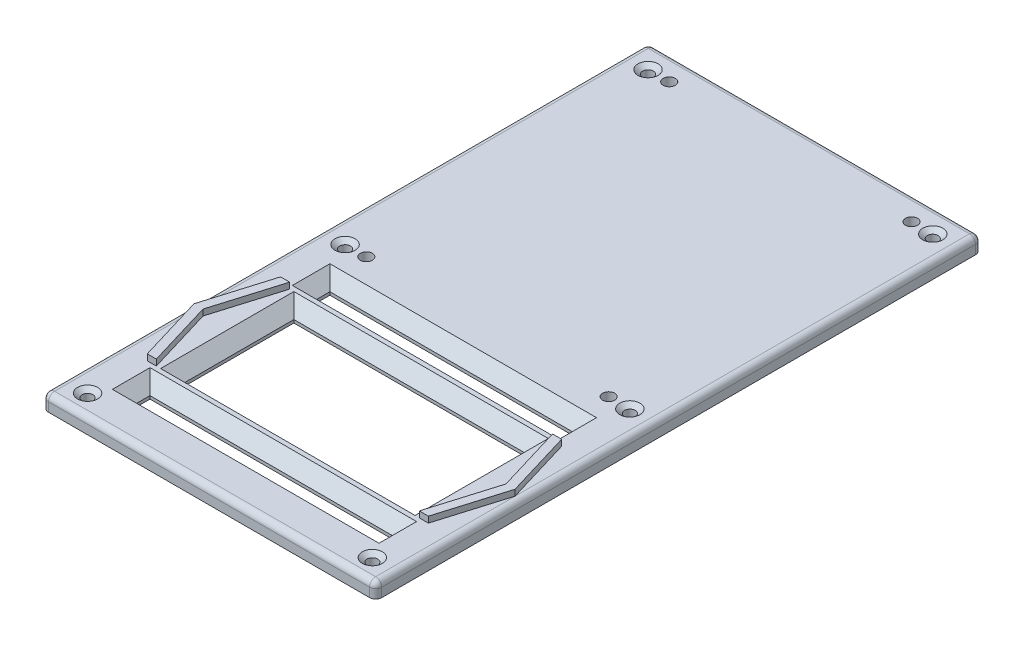
from build123d import *

# Parameters (mm, degrees)
SKETCH1_W                             = 139.7
SKETCH1_H                             = 254
BOSS_EXTRUDE1_DEPTH                   = 6.35
SKETCH2_W                             = 96.52
SKETCH2_H                             = 45.72
MAIN_HOLE_DEPTH                       = 240.117763874
SKETCH3_W                             = 101.6
SKETCH3_H                             = 5.588
NEOPIXEL_DEPTH                        = 240.117763874
CHAMFER1_SIZE                         = 5.08
CHAMFER2_SIZE                         = 5.08
CUT_EXTRUDE1_REACH                    = 241.118
SKETCH7_R                             = 2.54
BOSS_EXTRUDE4_DEPTH                   = 2.54
FRONT_BACK_MOUNTING_HOLES_D           = 4.4958
FRONT_BACK_MOUNTING_HOLES_CSINK_D     = 8.4328
FRONT_BACK_MOUNTING_HOLES_CSINK_ANGLE = 100
CORNER_FILLET_R                       = 2.54
FILLET2_R                             = 2.54


with BuildPart() as part:
    # Sketch1 → Boss-Extrude1 (new body)
    with BuildSketch(Plane(origin=(0, 0, 0), x_dir=(1, 0, 0), z_dir=(0, 1, 0))):
        with Locations((0, 101.6)):
            Rectangle(SKETCH1_W, SKETCH1_H)
    extrude(amount=BOSS_EXTRUDE1_DEPTH)

    # Sketch2 → Main Hole (cut, through all)
    with BuildSketch(Plane(origin=(0, 6.35, 0), x_dir=(1, 0, 0), z_dir=(0, 1, 0))):
        with Locations((0, 35.56)):
            Rectangle(SKETCH2_W, SKETCH2_H)
    extrude(amount=-MAIN_HOLE_DEPTH, mode=Mode.SUBTRACT)

    # Sketch3 → NeoPixel (cut, through all)
    with BuildSketch(Plane(origin=(0, 6.35, 0), x_dir=(1, 0, 0), z_dir=(0, 1, 0))):
        with Locations((0, 73.279)):
            Rectangle(SKETCH3_W, SKETCH3_H)
    neopixel = extrude(amount=-NEOPIXEL_DEPTH, mode=Mode.SUBTRACT)

    # Mirror2: NeoPixel across plane
    add(neopixel.mirror(Plane.XY.offset(-35.56)), mode=Mode.SUBTRACT)

    # Chamfer1
    chamfer1_edges = [part.edges().sort_by_distance(p)[0] for p in [
        (-50.8, 6.35, -73.279),
        (0, 6.35, -70.485),
        (50.8, 6.35, -73.279),
        (0, 6.35, -76.073),
        (-50.8, 6.35, 2.159),
        (0, 6.35, -0.635),
        (50.8, 6.35, 2.159),
        (0, 6.35, 4.953),
    ]]
    chamfer(chamfer1_edges, length=CHAMFER1_SIZE)

    # Chamfer2
    chamfer2_edges = [part.edges().sort_by_distance(p)[0] for p in [
        (48.26, 6.35, -35.56),
        (0, 6.35, -58.42),
        (-48.26, 6.35, -35.56),
        (0, 6.35, -12.7),
    ]]
    chamfer(chamfer2_edges, length=CHAMFER2_SIZE)

    # Sketch7 → Cut-Extrude1 (cut, up to next)
    with BuildSketch(Plane(origin=(0, 6.35, 0), x_dir=(1, 0, 0), z_dir=(0, 1, 0)), mode=Mode.PRIVATE) as cut_extrude1_sk1:
        with Locations(Location((50.8, 91.313, 0), (0, 0, 270))):
            Circle(SKETCH7_R)
    cut_extrude1_tool1 = extrude(cut_extrude1_sk1.sketch, amount=-CUT_EXTRUDE1_REACH, mode=Mode.PRIVATE) & part.part
    # Sketch7 → Cut-Extrude1 (cut, up to next)
    with BuildSketch(Plane(origin=(0, 6.35, 0), x_dir=(1, 0, 0), z_dir=(0, 1, 0)), mode=Mode.PRIVATE) as cut_extrude1_sk2:
        with Locations(Location((-50.8, 91.313, 0), (0, 0, 270))):
            Circle(SKETCH7_R)
    cut_extrude1_tool2 = extrude(cut_extrude1_sk2.sketch, amount=-CUT_EXTRUDE1_REACH, mode=Mode.PRIVATE) & part.part
    # Sketch7 → Cut-Extrude1 (cut, up to next)
    with BuildSketch(Plane(origin=(0, 6.35, 0), x_dir=(1, 0, 0), z_dir=(0, 1, 0)), mode=Mode.PRIVATE) as cut_extrude1_sk3:
        with Locations(Location((-50.8, 218.313, 0), (0, 0, 270))):
            Circle(SKETCH7_R)
    cut_extrude1_tool3 = extrude(cut_extrude1_sk3.sketch, amount=-CUT_EXTRUDE1_REACH, mode=Mode.PRIVATE) & part.part
    # Sketch7 → Cut-Extrude1 (cut, up to next)
    with BuildSketch(Plane(origin=(0, 6.35, 0), x_dir=(1, 0, 0), z_dir=(0, 1, 0)), mode=Mode.PRIVATE) as cut_extrude1_sk4:
        with Locations(Location((50.8, 218.313, 0), (0, 0, 270))):
            Circle(SKETCH7_R)
    cut_extrude1_tool4 = extrude(cut_extrude1_sk4.sketch, amount=-CUT_EXTRUDE1_REACH, mode=Mode.PRIVATE) & part.part
    add(cut_extrude1_tool1.solids().sort_by_distance((50.8, 6.35, -91.313))[0], mode=Mode.SUBTRACT)
    add(cut_extrude1_tool2.solids().sort_by_distance((-50.8, 6.35, -91.313))[0], mode=Mode.SUBTRACT)
    add(cut_extrude1_tool3.solids().sort_by_distance((-50.8, 6.35, -218.313))[0], mode=Mode.SUBTRACT)
    add(cut_extrude1_tool4.solids().sort_by_distance((50.8, 6.35, -218.313))[0], mode=Mode.SUBTRACT)

    # Sketch8 → Boss-Extrude4 (add)
    with BuildSketch(Plane(origin=(0, 6.35, 0), x_dir=(1, 0, 0), z_dir=(0, 1, 0))):
        Polygon((58.928, 63.5), (67.31, 35.56), (58.928, 7.62), (55.118, 7.62), (63.5, 35.56), (55.118, 63.5), align=None)
    boss_extrude4 = extrude(amount=BOSS_EXTRUDE4_DEPTH)

    # Mirror3: Boss-Extrude4 across plane
    add(boss_extrude4.mirror(Plane(origin=(0, 0, 0), x_dir=(0, 0, 1), z_dir=(1, 0, 0))))

    # Front-Back Mounting HOles (through all)
    with Locations(Plane(origin=(0, 6.35, 0), x_dir=(1, 0, 0), z_dir=(0, 1, 0))):
        with Locations((59.69, 218.313), (-59.69, 218.313), (-59.69, 91.313), (59.69, 91.313), (59.69, -16.637), (-59.69, -16.637)):
            CounterSinkHole(FRONT_BACK_MOUNTING_HOLES_D / 2, FRONT_BACK_MOUNTING_HOLES_CSINK_D / 2, counter_sink_angle=FRONT_BACK_MOUNTING_HOLES_CSINK_ANGLE)

    # Corner Fillet
    corner_fillet_edges = [part.edges().sort_by_distance(p)[0] for p in [
        (69.85, 3.175, 25.4),
        (-69.85, 3.175, 25.4),
        (-69.85, 3.175, -228.6),
        (69.85, 3.175, -228.6),
    ]]
    fillet(corner_fillet_edges, radius=CORNER_FILLET_R)

    # Fillet2
    fillet2_edges = [part.edges().sort_by_distance(p)[0] for p in [
        (-69.85, 6.35, -101.6),
        (0, 6.35, -228.6),
        (69.85, 6.35, -101.6),
        (0, 6.35, 25.4),
        (69.106051224, 6.35, 24.656051224),
        (-69.106051224, 6.35, 24.656051224),
        (69.106051224, 6.35, -227.856051224),
        (-69.106051224, 6.35, -227.856051224),
    ]]
    fillet(fillet2_edges, radius=FILLET2_R - 0.0001)  # a hair under: the kernel refuses the full size


solid = part.part
